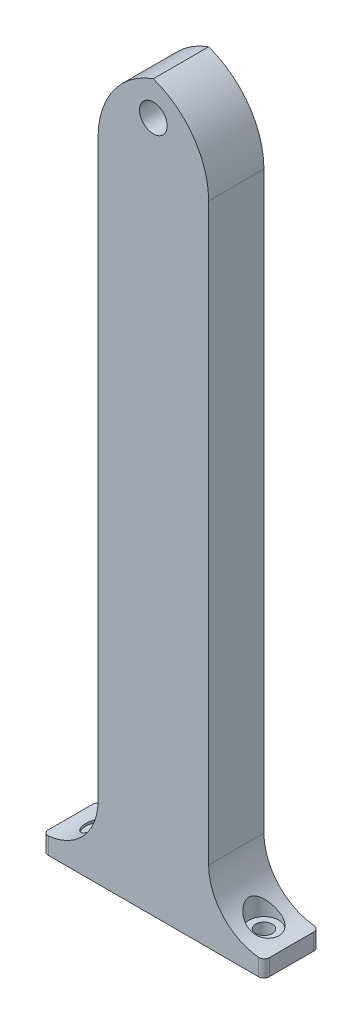
from build123d import *

# Parameters (mm, degrees)
SKETCH2_W               = 20
SKETCH2_H               = 10
BOSS_EXTRUDE1_DEPTH     = 132
SKETCH6_W               = 10
SKETCH6_H               = 3
BOSS_EXTRUDE2_DEPTH     = 10
FILLET2_R               = 10
CUT_EXTRUDE5_DEPTH      = 131.636901372
CUT_EXTRUDE5_DEPTH_BACK = 131.636901372
SKETCH19_R              = 1.5
SKETCH19_5_R            = 2.7
SKETCH19_5_R_2          = 1.5
CUT_EXTRUDE7_DEPTH      = 131.636901376
FILLET1_R               = 1
FILLET3_R               = 10
CUT_EXTRUDE8_DEPTH      = 131.636901391
CUT_EXTRUDE8_DEPTH_BACK = 131.636901391
SKETCH20_R              = 1.5
SKETCH20_3_R            = 2.7
SKETCH20_3_R_2          = 1.5
CUT_EXTRUDE9_DEPTH      = 131.636901391
SKETCH21_R              = 2.5
CUT_EXTRUDE10_DEPTH     = 10
FILLET4_R               = 15


# Some blends are built 0.0001 mm under size
with BuildPart() as part:
    # Sketch2 → Boss-Extrude1 (new body)
    with BuildSketch(Plane(origin=(0, 0, 0), x_dir=(1, 0, 0), z_dir=(0, 1, 0))):
        Rectangle(SKETCH2_W, SKETCH2_H)
    extrude(amount=BOSS_EXTRUDE1_DEPTH)

    # Sketch6 → Boss-Extrude2 (add)
    with BuildSketch(Plane(origin=(10, 0, 0), x_dir=(0, 0, -1), z_dir=(1, 0, 0))):
        with Locations((0, 1.5)):
            Rectangle(SKETCH6_W, SKETCH6_H)
    boss_extrude2 = extrude(amount=BOSS_EXTRUDE2_DEPTH)

    # Fillet2
    fillet2_edges = [part.edges().sort_by_distance(p)[0] for p in [
        (10, 3, 0),
    ]]
    fillet(fillet2_edges, radius=FILLET2_R - 0.0001)  # a hair under: the kernel refuses the full size

    # Sketch19 → Cut-Extrude5 (cut, two sides: drawn at the far end of the back side and taken through both)
    with BuildSketch(Plane(origin=(0, 3, 0), x_dir=(1, 0, 0), z_dir=(0, 1, 0)).offset(-CUT_EXTRUDE5_DEPTH_BACK)):
        with Locations(Location((15, 0, 0), (0, 0, 270))):
            Circle(SKETCH19_R)
    extrude(amount=CUT_EXTRUDE5_DEPTH + CUT_EXTRUDE5_DEPTH_BACK, mode=Mode.SUBTRACT)

    # Sketch19<5> → Cut-Extrude7 (cut, through all)
    with BuildSketch(Plane(origin=(0, 3, 0), x_dir=(1, 0, 0), z_dir=(0, 1, 0))):
        with Locations(Location((15, 0, 0), (0, 0, 90))):
            Circle(SKETCH19_5_R)
        with Locations(Location((15, 0, 0), (0, 0, 270))):
            Circle(SKETCH19_5_R_2, mode=Mode.SUBTRACT)
    extrude(amount=CUT_EXTRUDE7_DEPTH, mode=Mode.SUBTRACT)

    # Mirror16: Boss-Extrude2 across plane
    add(boss_extrude2.mirror(Plane(origin=(0, 0, 0), x_dir=(0, 0, 1), z_dir=(1, 0, 0))))

    # Fillet1
    fillet1_edges = [part.edges().sort_by_distance(p)[0] for p in [
        (20, 1.5, 5),
        (20, 1.5, -5),
        (-20, 1.5, 5),
        (-20, 1.5, -5),
    ]]
    fillet(fillet1_edges, radius=FILLET1_R)

    # Fillet3
    fillet3_edges = [part.edges().sort_by_distance(p)[0] for p in [
        (-10, 3, 0),
    ]]
    fillet(fillet3_edges, radius=FILLET3_R - 0.0001)  # a hair under: the kernel refuses the full size

    # Sketch20 → Cut-Extrude8 (cut, two sides: drawn at the far end of the back side and taken through both)
    with BuildSketch(Plane(origin=(0, 3, 0), x_dir=(1, 0, 0), z_dir=(0, 1, 0)).offset(-CUT_EXTRUDE8_DEPTH_BACK)):
        with Locations(Location((-14.5, 0, 0), (0, 0, 270))):
            Circle(SKETCH20_R)
    extrude(amount=CUT_EXTRUDE8_DEPTH + CUT_EXTRUDE8_DEPTH_BACK, mode=Mode.SUBTRACT)

    # Sketch20<3> → Cut-Extrude9 (cut, through all)
    with BuildSketch(Plane(origin=(0, 3, 0), x_dir=(1, 0, 0), z_dir=(0, 1, 0))):
        with Locations(Location((-14.5, 0, 0), (0, 0, 90))):
            Circle(SKETCH20_3_R)
        with Locations(Location((-14.5, 0, 0), (0, 0, 270))):
            Circle(SKETCH20_3_R_2, mode=Mode.SUBTRACT)
    extrude(amount=CUT_EXTRUDE9_DEPTH, mode=Mode.SUBTRACT)

    # Sketch21 → Cut-Extrude10 (cut)
    with BuildSketch(Plane.XY.offset(5)):
        with Locations((0, 125)):
            Circle(SKETCH21_R)
    extrude(amount=-CUT_EXTRUDE10_DEPTH, mode=Mode.SUBTRACT)

    # Fillet4
    # the kernel refuses this fillet: 15 mm, written as the material it takes off along each edge
    with BuildSketch(Plane(origin=(-10, 132, 42.5), x_dir=(0, -1, 0), z_dir=(0, 0, -1))) as fillet4_piece_1:
        with BuildLine():
            CenterArc((FILLET4_R, -FILLET4_R), FILLET4_R, 90, 90)
            Line((0, -FILLET4_R), (0, 0))
            Line((0, 0), (FILLET4_R, 0))
        make_face()
    extrude(amount=85, mode=Mode.SUBTRACT)
    with BuildSketch(Plane(origin=(10, 132, -42.5), x_dir=(-1, 0, 0), z_dir=(0, 0, 1))) as fillet4_piece_2:
        with BuildLine():
            CenterArc((FILLET4_R, FILLET4_R), FILLET4_R, 180, 90)
            Line((0, FILLET4_R), (0, 0))
            Line((0, 0), (FILLET4_R, 0))
        make_face()
    extrude(amount=85, mode=Mode.SUBTRACT)


solid = part.part
